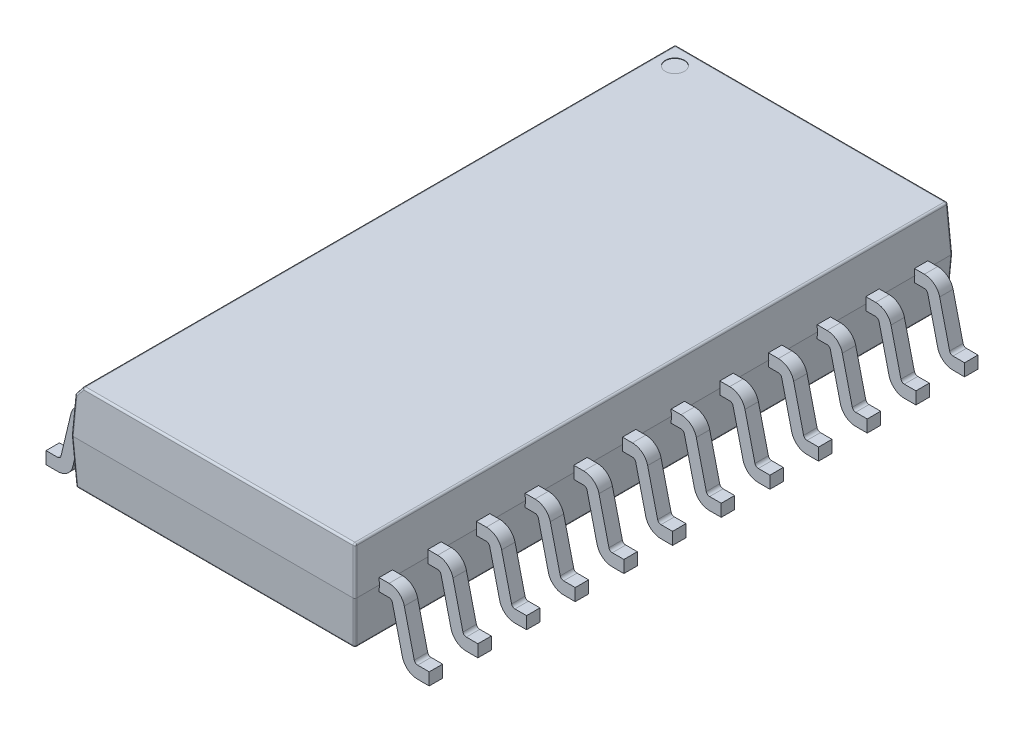
from build123d import *

# Parameters (mm, degrees)
SKETCH1_W                = 7.4
SKETCH1_H                = 15.6
EXTRUDE1_DEPTH           = 1.175
EXTRUDE1_TAPER           = 3
EXTRUDE1_OTHER_WAY_DEPTH = 1.175
EXTRUDE1_OTHER_WAY_TAPER = 3
CHAMFER1_SIZE            = 0.25
CHAMFER1_SIZE_2          = 0.181969736
FILLET1_R                = 0.05
SKETCH3_W                = 0.35
SKETCH3_H                = 0.32
LPATTERN1_START          = -7.16
LPATTERN1_DEPTH          = 0.35
LPATTERN1_START_2        = -5.89
LPATTERN1_2_DEPTH        = 0.35
LPATTERN1_START_3        = -4.62
LPATTERN1_3_DEPTH        = 0.35
LPATTERN1_START_4        = -3.35
LPATTERN1_4_DEPTH        = 0.35
LPATTERN1_START_5        = -2.08
LPATTERN1_5_DEPTH        = 0.35
LPATTERN1_START_6        = -0.81
LPATTERN1_6_DEPTH        = 0.35
LPATTERN1_START_7        = 1.73
LPATTERN1_7_DEPTH        = 0.35
LPATTERN1_START_8        = 3
LPATTERN1_8_DEPTH        = 0.35
LPATTERN1_START_9        = 4.27
LPATTERN1_9_DEPTH        = 0.35
LPATTERN1_START_10       = 5.54
LPATTERN1_10_DEPTH       = 0.35
LPATTERN1_START_11       = 6.81
LPATTERN1_11_DEPTH       = 0.35
SKETCH4_R                = 0.25
CUT_EXTRUDE1_DEPTH       = 0.01


# Read off the part's stored shape, not the designer's step: LPattern1
with BuildPart() as part:
    # Sketch1 → Extrude1 (new body)
    with BuildSketch(Plane(origin=(0, 0, 0), x_dir=(1, 0, 0), z_dir=(0, 1, 0))):
        Rectangle(SKETCH1_W, SKETCH1_H)
    extrude(amount=EXTRUDE1_DEPTH, taper=EXTRUDE1_TAPER)

    # Sketch1 → Extrude1 other way (add)
    with BuildSketch(Plane(origin=(0, 0, 0), x_dir=(1, 0, 0), z_dir=(0, 1, 0))):
        Rectangle(SKETCH1_W, SKETCH1_H)
    extrude(amount=-EXTRUDE1_OTHER_WAY_DEPTH, taper=EXTRUDE1_OTHER_WAY_TAPER)

    # Chamfer1
    # the kernel refuses this chamfer: 0.25, 0.181969736 mm, written as the material it takes off along each edge
    with BuildSketch(Plane(origin=(-3.638420859, 1.175, -8.384058917), x_dir=(-0.07450228339380831, -0.9972208430278162, 0), z_dir=(0, 0, 1))) as chamfer1_piece_1:
        Polygon((CHAMFER1_SIZE * 0.999753334764, CHAMFER1_SIZE * 0.0222096741985), (-CHAMFER1_SIZE_2 * 0.0745022835439, CHAMFER1_SIZE_2 * 0.997220845036), (0, 0), align=None)
    extrude(amount=16.768117834, mode=Mode.SUBTRACT)

    # Fillet1
    fillet1_edges = [part.edges().sort_by_distance(p)[0] for p in [
        (3.638420859, -1.175, 0),
        (0, -1.175, -7.738420859),
        (3.66921043, 0.5875, 7.76921043),
        (3.66921043, 0.5875, -7.76921043),
        (3.638420859, 1.175, 0),
        (0.090984868, 1.175, -7.738420859),
        (0.090984868, 1.175, 7.738420859),
        (-3.456451123, 1.175, 0),
        (-3.675752424, 0.462671308, 7.775752424),
        (-3.553977986, 1.050171308, 7.744962854),
        (-3.675752424, 0.462671308, -7.775752424),
        (-3.651504848, 0.925342616, 0),
        (-3.553977986, 1.050171308, -7.744962854),
        (-3.638420859, -1.175, 0),
        (0, -1.175, 7.738420859),
        (-3.66921043, -0.5875, -7.76921043),
        (3.66921043, -0.5875, -7.76921043),
        (3.66921043, -0.5875, 7.76921043),
        (-3.66921043, -0.5875, 7.76921043),
    ]]
    fillet(fillet1_edges, radius=FILLET1_R)

    # Sweep1: sweep along a path in Sketch2
    with BuildLine(Plane.XY.offset(0.635)) as sweep1_path:
        Line((-5, -1.475), (-4.697352983, -1.475))
        ThreePointArc((-4.697352983, -1.475), (-4.542449376, -1.421226584), (-4.454183337, -1.283038979))
        Line((-4.454183337, -1.283038979), (-4.193768223, -0.191961021))
        ThreePointArc((-4.193768223, -0.191961021), (-4.105502184, -0.053773416), (-3.950598576, 0))
        Line((-3.950598576, 0), (-3.64795156, 0))
    # Sketch3 → Sweep1 (sweep)
    with BuildSketch(Plane(origin=(-5, 0, 0), x_dir=(0, 0, -1), z_dir=(1, 0, 0))):
        with Locations((-0.635, -1.475)):
            Rectangle(SKETCH3_W, SKETCH3_H)
    sweep1 = sweep(path=sweep1_path.line)

    # LPattern1 outline → LPattern1 (add)
    with BuildSketch(Plane.XY.offset(LPATTERN1_START)):
        with BuildLine():
            Line((-3.7, 0), (-3.691614755, 0.16))
            Line((-3.691614755, 0.16), (-3.950598576, 0.16))
            ThreePointArc((-3.950598576, 0.16), (-4.204640492, 0.071811598), (-4.349396796, -0.154816074))
            Line((-4.349396796, -0.154816074), (-4.609811911, -1.245894033))
            ThreePointArc((-4.609811911, -1.245894033), (-4.641587685, -1.29564157), (-4.697352983, -1.315))
            Line((-4.697352983, -1.315), (-5, -1.315))
            Line((-5, -1.315), (-5, -1.635))
            Line((-5, -1.635), (-4.697352983, -1.635))
            ThreePointArc((-4.697352983, -1.635), (-4.443311067, -1.546811598), (-4.298554763, -1.320183926))
            Line((-4.298554763, -1.320183926), (-4.038139649, -0.229105967))
            ThreePointArc((-4.038139649, -0.229105967), (-4.006363875, -0.17935843), (-3.950598576, -0.16))
            Line((-3.950598576, -0.16), (-3.691614755, -0.16))
            Line((-3.691614755, -0.16), (-3.7, 0))
        make_face()
    lpattern1 = extrude(amount=LPATTERN1_DEPTH)

    # LPattern1 2 outline → LPattern1 2 (add)
    with BuildSketch(Plane.XY.offset(LPATTERN1_START_2)):
        with BuildLine():
            Line((-3.7, 0), (-3.691614755, 0.16))
            Line((-3.691614755, 0.16), (-3.950598576, 0.16))
            ThreePointArc((-3.950598576, 0.16), (-4.204640492, 0.071811598), (-4.349396796, -0.154816074))
            Line((-4.349396796, -0.154816074), (-4.609811911, -1.245894033))
            ThreePointArc((-4.609811911, -1.245894033), (-4.641587685, -1.29564157), (-4.697352983, -1.315))
            Line((-4.697352983, -1.315), (-5, -1.315))
            Line((-5, -1.315), (-5, -1.635))
            Line((-5, -1.635), (-4.697352983, -1.635))
            ThreePointArc((-4.697352983, -1.635), (-4.443311067, -1.546811598), (-4.298554763, -1.320183926))
            Line((-4.298554763, -1.320183926), (-4.038139649, -0.229105967))
            ThreePointArc((-4.038139649, -0.229105967), (-4.006363875, -0.17935843), (-3.950598576, -0.16))
            Line((-3.950598576, -0.16), (-3.691614755, -0.16))
            Line((-3.691614755, -0.16), (-3.7, 0))
        make_face()
    lpattern1_2 = extrude(amount=LPATTERN1_2_DEPTH)

    # LPattern1 3 outline → LPattern1 3 (add)
    with BuildSketch(Plane.XY.offset(LPATTERN1_START_3)):
        with BuildLine():
            Line((-3.7, 0), (-3.691614755, 0.16))
            Line((-3.691614755, 0.16), (-3.950598576, 0.16))
            ThreePointArc((-3.950598576, 0.16), (-4.204640492, 0.071811598), (-4.349396796, -0.154816074))
            Line((-4.349396796, -0.154816074), (-4.609811911, -1.245894033))
            ThreePointArc((-4.609811911, -1.245894033), (-4.641587685, -1.29564157), (-4.697352983, -1.315))
            Line((-4.697352983, -1.315), (-5, -1.315))
            Line((-5, -1.315), (-5, -1.635))
            Line((-5, -1.635), (-4.697352983, -1.635))
            ThreePointArc((-4.697352983, -1.635), (-4.443311067, -1.546811598), (-4.298554763, -1.320183926))
            Line((-4.298554763, -1.320183926), (-4.038139649, -0.229105967))
            ThreePointArc((-4.038139649, -0.229105967), (-4.006363875, -0.17935843), (-3.950598576, -0.16))
            Line((-3.950598576, -0.16), (-3.691614755, -0.16))
            Line((-3.691614755, -0.16), (-3.7, 0))
        make_face()
    lpattern1_3 = extrude(amount=LPATTERN1_3_DEPTH)

    # LPattern1 4 outline → LPattern1 4 (add)
    with BuildSketch(Plane.XY.offset(LPATTERN1_START_4)):
        with BuildLine():
            Line((-3.7, 0), (-3.691614755, 0.16))
            Line((-3.691614755, 0.16), (-3.950598576, 0.16))
            ThreePointArc((-3.950598576, 0.16), (-4.204640492, 0.071811598), (-4.349396796, -0.154816074))
            Line((-4.349396796, -0.154816074), (-4.609811911, -1.245894033))
            ThreePointArc((-4.609811911, -1.245894033), (-4.641587685, -1.29564157), (-4.697352983, -1.315))
            Line((-4.697352983, -1.315), (-5, -1.315))
            Line((-5, -1.315), (-5, -1.635))
            Line((-5, -1.635), (-4.697352983, -1.635))
            ThreePointArc((-4.697352983, -1.635), (-4.443311067, -1.546811598), (-4.298554763, -1.320183926))
            Line((-4.298554763, -1.320183926), (-4.038139649, -0.229105967))
            ThreePointArc((-4.038139649, -0.229105967), (-4.006363875, -0.17935843), (-3.950598576, -0.16))
            Line((-3.950598576, -0.16), (-3.691614755, -0.16))
            Line((-3.691614755, -0.16), (-3.7, 0))
        make_face()
    lpattern1_4 = extrude(amount=LPATTERN1_4_DEPTH)

    # LPattern1 5 outline → LPattern1 5 (add)
    with BuildSketch(Plane.XY.offset(LPATTERN1_START_5)):
        with BuildLine():
            Line((-3.7, 0), (-3.691614755, 0.16))
            Line((-3.691614755, 0.16), (-3.950598576, 0.16))
            ThreePointArc((-3.950598576, 0.16), (-4.204640492, 0.071811598), (-4.349396796, -0.154816074))
            Line((-4.349396796, -0.154816074), (-4.609811911, -1.245894033))
            ThreePointArc((-4.609811911, -1.245894033), (-4.641587685, -1.29564157), (-4.697352983, -1.315))
            Line((-4.697352983, -1.315), (-5, -1.315))
            Line((-5, -1.315), (-5, -1.635))
            Line((-5, -1.635), (-4.697352983, -1.635))
            ThreePointArc((-4.697352983, -1.635), (-4.443311067, -1.546811598), (-4.298554763, -1.320183926))
            Line((-4.298554763, -1.320183926), (-4.038139649, -0.229105967))
            ThreePointArc((-4.038139649, -0.229105967), (-4.006363875, -0.17935843), (-3.950598576, -0.16))
            Line((-3.950598576, -0.16), (-3.691614755, -0.16))
            Line((-3.691614755, -0.16), (-3.7, 0))
        make_face()
    lpattern1_5 = extrude(amount=LPATTERN1_5_DEPTH)

    # LPattern1 6 outline → LPattern1 6 (add)
    with BuildSketch(Plane.XY.offset(LPATTERN1_START_6)):
        with BuildLine():
            Line((-3.7, 0), (-3.691614755, 0.16))
            Line((-3.691614755, 0.16), (-3.950598576, 0.16))
            ThreePointArc((-3.950598576, 0.16), (-4.204640492, 0.071811598), (-4.349396796, -0.154816074))
            Line((-4.349396796, -0.154816074), (-4.609811911, -1.245894033))
            ThreePointArc((-4.609811911, -1.245894033), (-4.641587685, -1.29564157), (-4.697352983, -1.315))
            Line((-4.697352983, -1.315), (-5, -1.315))
            Line((-5, -1.315), (-5, -1.635))
            Line((-5, -1.635), (-4.697352983, -1.635))
            ThreePointArc((-4.697352983, -1.635), (-4.443311067, -1.546811598), (-4.298554763, -1.320183926))
            Line((-4.298554763, -1.320183926), (-4.038139649, -0.229105967))
            ThreePointArc((-4.038139649, -0.229105967), (-4.006363875, -0.17935843), (-3.950598576, -0.16))
            Line((-3.950598576, -0.16), (-3.691614755, -0.16))
            Line((-3.691614755, -0.16), (-3.7, 0))
        make_face()
    lpattern1_6 = extrude(amount=LPATTERN1_6_DEPTH)

    # LPattern1 7 outline → LPattern1 7 (add)
    with BuildSketch(Plane.XY.offset(LPATTERN1_START_7)):
        with BuildLine():
            Line((-3.7, 0), (-3.691614755, 0.16))
            Line((-3.691614755, 0.16), (-3.950598576, 0.16))
            ThreePointArc((-3.950598576, 0.16), (-4.204640492, 0.071811598), (-4.349396796, -0.154816074))
            Line((-4.349396796, -0.154816074), (-4.609811911, -1.245894033))
            ThreePointArc((-4.609811911, -1.245894033), (-4.641587685, -1.29564157), (-4.697352983, -1.315))
            Line((-4.697352983, -1.315), (-5, -1.315))
            Line((-5, -1.315), (-5, -1.635))
            Line((-5, -1.635), (-4.697352983, -1.635))
            ThreePointArc((-4.697352983, -1.635), (-4.443311067, -1.546811598), (-4.298554763, -1.320183926))
            Line((-4.298554763, -1.320183926), (-4.038139649, -0.229105967))
            ThreePointArc((-4.038139649, -0.229105967), (-4.006363875, -0.17935843), (-3.950598576, -0.16))
            Line((-3.950598576, -0.16), (-3.691614755, -0.16))
            Line((-3.691614755, -0.16), (-3.7, 0))
        make_face()
    lpattern1_7 = extrude(amount=LPATTERN1_7_DEPTH)

    # LPattern1 8 outline → LPattern1 8 (add)
    with BuildSketch(Plane.XY.offset(LPATTERN1_START_8)):
        with BuildLine():
            Line((-3.7, 0), (-3.691614755, 0.16))
            Line((-3.691614755, 0.16), (-3.950598576, 0.16))
            ThreePointArc((-3.950598576, 0.16), (-4.204640492, 0.071811598), (-4.349396796, -0.154816074))
            Line((-4.349396796, -0.154816074), (-4.609811911, -1.245894033))
            ThreePointArc((-4.609811911, -1.245894033), (-4.641587685, -1.29564157), (-4.697352983, -1.315))
            Line((-4.697352983, -1.315), (-5, -1.315))
            Line((-5, -1.315), (-5, -1.635))
            Line((-5, -1.635), (-4.697352983, -1.635))
            ThreePointArc((-4.697352983, -1.635), (-4.443311067, -1.546811598), (-4.298554763, -1.320183926))
            Line((-4.298554763, -1.320183926), (-4.038139649, -0.229105967))
            ThreePointArc((-4.038139649, -0.229105967), (-4.006363875, -0.17935843), (-3.950598576, -0.16))
            Line((-3.950598576, -0.16), (-3.691614755, -0.16))
            Line((-3.691614755, -0.16), (-3.7, 0))
        make_face()
    lpattern1_8 = extrude(amount=LPATTERN1_8_DEPTH)

    # LPattern1 9 outline → LPattern1 9 (add)
    with BuildSketch(Plane.XY.offset(LPATTERN1_START_9)):
        with BuildLine():
            Line((-3.7, 0), (-3.691614755, 0.16))
            Line((-3.691614755, 0.16), (-3.950598576, 0.16))
            ThreePointArc((-3.950598576, 0.16), (-4.204640492, 0.071811598), (-4.349396796, -0.154816074))
            Line((-4.349396796, -0.154816074), (-4.609811911, -1.245894033))
            ThreePointArc((-4.609811911, -1.245894033), (-4.641587685, -1.29564157), (-4.697352983, -1.315))
            Line((-4.697352983, -1.315), (-5, -1.315))
            Line((-5, -1.315), (-5, -1.635))
            Line((-5, -1.635), (-4.697352983, -1.635))
            ThreePointArc((-4.697352983, -1.635), (-4.443311067, -1.546811598), (-4.298554763, -1.320183926))
            Line((-4.298554763, -1.320183926), (-4.038139649, -0.229105967))
            ThreePointArc((-4.038139649, -0.229105967), (-4.006363875, -0.17935843), (-3.950598576, -0.16))
            Line((-3.950598576, -0.16), (-3.691614755, -0.16))
            Line((-3.691614755, -0.16), (-3.7, 0))
        make_face()
    lpattern1_9 = extrude(amount=LPATTERN1_9_DEPTH)

    # LPattern1 10 outline → LPattern1 10 (add)
    with BuildSketch(Plane.XY.offset(LPATTERN1_START_10)):
        with BuildLine():
            Line((-3.7, 0), (-3.691614755, 0.16))
            Line((-3.691614755, 0.16), (-3.950598576, 0.16))
            ThreePointArc((-3.950598576, 0.16), (-4.204640492, 0.071811598), (-4.349396796, -0.154816074))
            Line((-4.349396796, -0.154816074), (-4.609811911, -1.245894033))
            ThreePointArc((-4.609811911, -1.245894033), (-4.641587685, -1.29564157), (-4.697352983, -1.315))
            Line((-4.697352983, -1.315), (-5, -1.315))
            Line((-5, -1.315), (-5, -1.635))
            Line((-5, -1.635), (-4.697352983, -1.635))
            ThreePointArc((-4.697352983, -1.635), (-4.443311067, -1.546811598), (-4.298554763, -1.320183926))
            Line((-4.298554763, -1.320183926), (-4.038139649, -0.229105967))
            ThreePointArc((-4.038139649, -0.229105967), (-4.006363875, -0.17935843), (-3.950598576, -0.16))
            Line((-3.950598576, -0.16), (-3.691614755, -0.16))
            Line((-3.691614755, -0.16), (-3.7, 0))
        make_face()
    lpattern1_10 = extrude(amount=LPATTERN1_10_DEPTH)

    # LPattern1 11 outline → LPattern1 11 (add)
    with BuildSketch(Plane.XY.offset(LPATTERN1_START_11)):
        with BuildLine():
            Line((-3.7, 0), (-3.691614755, 0.16))
            Line((-3.691614755, 0.16), (-3.950598576, 0.16))
            ThreePointArc((-3.950598576, 0.16), (-4.204640492, 0.071811598), (-4.349396796, -0.154816074))
            Line((-4.349396796, -0.154816074), (-4.609811911, -1.245894033))
            ThreePointArc((-4.609811911, -1.245894033), (-4.641587685, -1.29564157), (-4.697352983, -1.315))
            Line((-4.697352983, -1.315), (-5, -1.315))
            Line((-5, -1.315), (-5, -1.635))
            Line((-5, -1.635), (-4.697352983, -1.635))
            ThreePointArc((-4.697352983, -1.635), (-4.443311067, -1.546811598), (-4.298554763, -1.320183926))
            Line((-4.298554763, -1.320183926), (-4.038139649, -0.229105967))
            ThreePointArc((-4.038139649, -0.229105967), (-4.006363875, -0.17935843), (-3.950598576, -0.16))
            Line((-3.950598576, -0.16), (-3.691614755, -0.16))
            Line((-3.691614755, -0.16), (-3.7, 0))
        make_face()
    lpattern1_11 = extrude(amount=LPATTERN1_11_DEPTH)

    # Sketch4 → Cut-Extrude1 (cut)
    with BuildSketch(Plane(origin=(0, 1.175, 0), x_dir=(1, 0, 0), z_dir=(0, 1, 0))):
        with Locations(Location((-3, 7.25, 0), (0, 0, 270))):
            Circle(SKETCH4_R)
    extrude(amount=-CUT_EXTRUDE1_DEPTH, mode=Mode.SUBTRACT)

    # Mirror1: Sweep1, LPattern1, LPattern1 2, LPattern1 3, LPattern1 4, LPattern1 5, LPattern1 6, LPattern1 7, LPattern1 8, LPattern1 9, LPattern1 10, LPattern1 11 across plane
    add(sweep1.mirror(Plane(origin=(0, 0, 0), x_dir=(0, 0, 1), z_dir=(1, 0, 0))))
    add(lpattern1.mirror(Plane(origin=(0, 0, 0), x_dir=(0, 0, 1), z_dir=(1, 0, 0))))
    add(lpattern1_2.mirror(Plane(origin=(0, 0, 0), x_dir=(0, 0, 1), z_dir=(1, 0, 0))))
    add(lpattern1_3.mirror(Plane(origin=(0, 0, 0), x_dir=(0, 0, 1), z_dir=(1, 0, 0))))
    add(lpattern1_4.mirror(Plane(origin=(0, 0, 0), x_dir=(0, 0, 1), z_dir=(1, 0, 0))))
    add(lpattern1_5.mirror(Plane(origin=(0, 0, 0), x_dir=(0, 0, 1), z_dir=(1, 0, 0))))
    add(lpattern1_6.mirror(Plane(origin=(0, 0, 0), x_dir=(0, 0, 1), z_dir=(1, 0, 0))))
    add(lpattern1_7.mirror(Plane(origin=(0, 0, 0), x_dir=(0, 0, 1), z_dir=(1, 0, 0))))
    add(lpattern1_8.mirror(Plane(origin=(0, 0, 0), x_dir=(0, 0, 1), z_dir=(1, 0, 0))))
    add(lpattern1_9.mirror(Plane(origin=(0, 0, 0), x_dir=(0, 0, 1), z_dir=(1, 0, 0))))
    add(lpattern1_10.mirror(Plane(origin=(0, 0, 0), x_dir=(0, 0, 1), z_dir=(1, 0, 0))))
    add(lpattern1_11.mirror(Plane(origin=(0, 0, 0), x_dir=(0, 0, 1), z_dir=(1, 0, 0))))


solid = part.part
